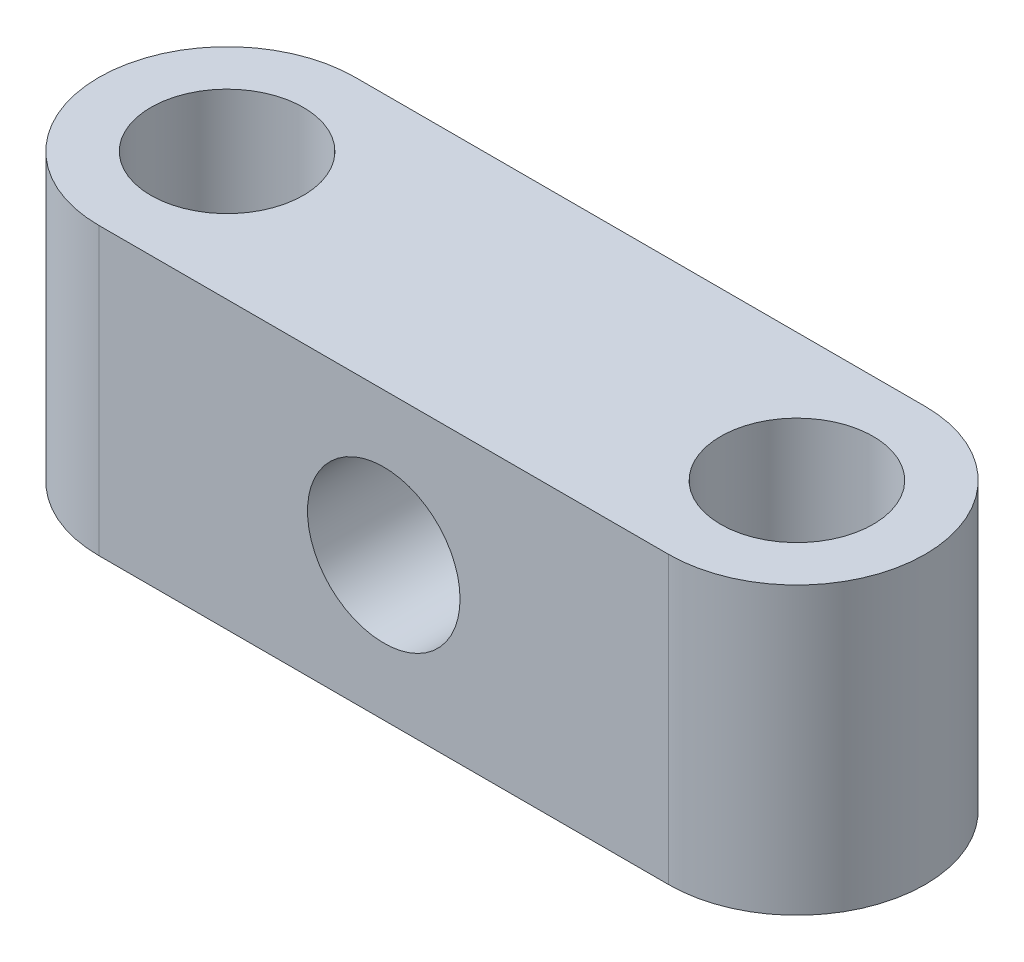
from build123d import *

# Parameters (mm, degrees)
SKETCH1_R              = 2.4
BOSS_EXTRUDE2_DEPTH    = 9
CUT_EXTRUDE2_START     = -12.485338913
CUT_EXTRUDE2_OUTLINE_R = 2.4
CUT_EXTRUDE2_DEPTH     = 8.07


# Read off the part's stored shape, not the designer's step: Cut-Extrude2
with BuildPart() as part:
    # Sketch1 → Boss-Extrude2 (new body)
    with BuildSketch(Plane(origin=(0, 0, 0), x_dir=(1, 0, 0), z_dir=(0, 1, 0))):
        with BuildLine():
            Line((-49.891335879, 12.485338913), (-67.821335879, 12.485338913))
            ThreePointArc((-67.821335879, 12.485338913), (-70.674511741, 11.303514775), (-71.856335879, 8.450338913))
            ThreePointArc((-71.856335879, 8.450338913), (-70.674511741, 5.597163051), (-67.821335879, 4.415338913))
            Line((-67.821335879, 4.415338913), (-49.891335879, 4.415338913))
            ThreePointArc((-49.891335879, 4.415338913), (-47.038160017, 5.597163051), (-45.856335879, 8.450338913))
            ThreePointArc((-45.856335879, 8.450338913), (-47.038160017, 11.303514775), (-49.891335879, 12.485338913))
        make_face()
        with Locations(Location((-67.821335879, 8.450338913, 0), (0, 0, 270))):
            Circle(SKETCH1_R, mode=Mode.SUBTRACT)
        with Locations(Location((-49.891335879, 8.450338913, 0), (0, 0, 270))):
            Circle(SKETCH1_R, mode=Mode.SUBTRACT)
    extrude(amount=BOSS_EXTRUDE2_DEPTH)

    # Cut-Extrude2 outline → Cut-Extrude2 (cut)
    with BuildSketch(Plane.XY.offset(CUT_EXTRUDE2_START)):
        with Locations((-58.856335879, 4.5)):
            Circle(CUT_EXTRUDE2_OUTLINE_R)
    extrude(amount=CUT_EXTRUDE2_DEPTH, mode=Mode.SUBTRACT)


solid = part.part
